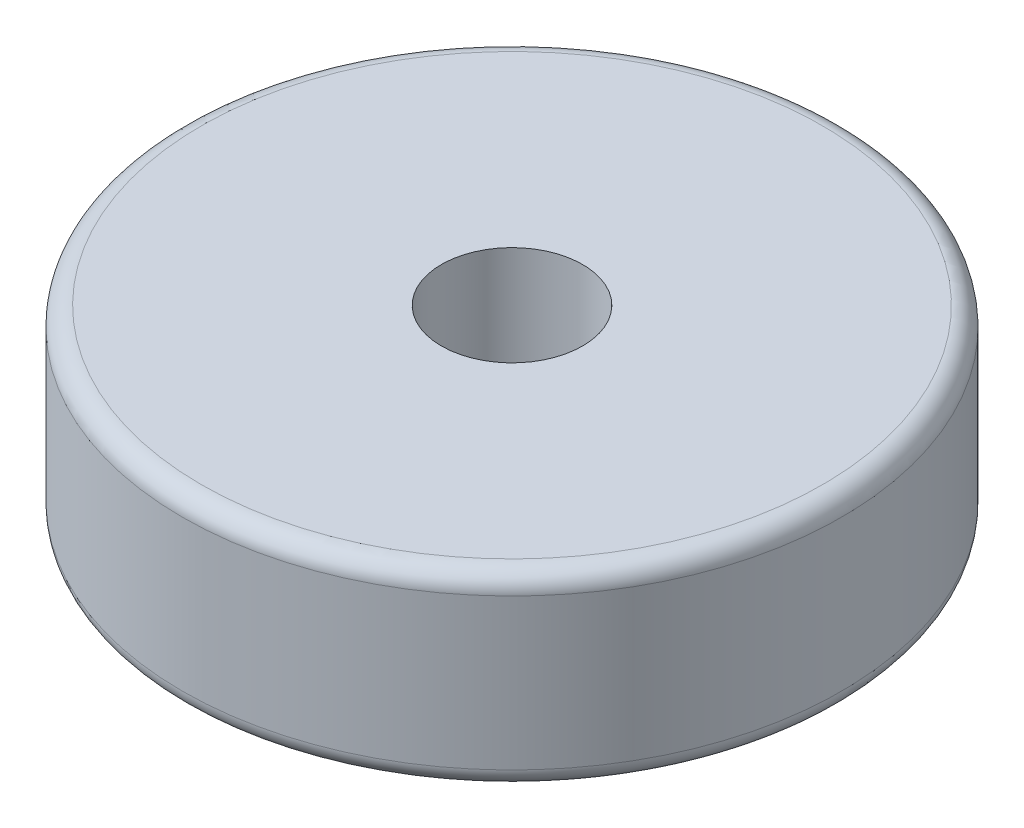
from build123d import *

# Parameters (mm, degrees)
SKETCH1_R           = 44.45
SKETCH1_R_2         = 9.525
BOSS_EXTRUDE1_DEPTH = 25.4
FILLET1_R           = 2.54


with BuildPart() as part:
    # Sketch1 → Boss-Extrude1 (new body)
    with BuildSketch(Plane(origin=(0, 0, 0), x_dir=(1, 0, 0), z_dir=(0, 1, 0))):
        Circle(SKETCH1_R)
        Circle(SKETCH1_R_2, mode=Mode.SUBTRACT)
    extrude(amount=BOSS_EXTRUDE1_DEPTH)

    # Fillet1
    fillet1_edges = [part.edges().sort_by_distance(p)[0] for p in [
        (-44.45, 0, 0),
        (-44.45, 25.4, 0),
    ]]
    fillet(fillet1_edges, radius=FILLET1_R)


solid = part.part
